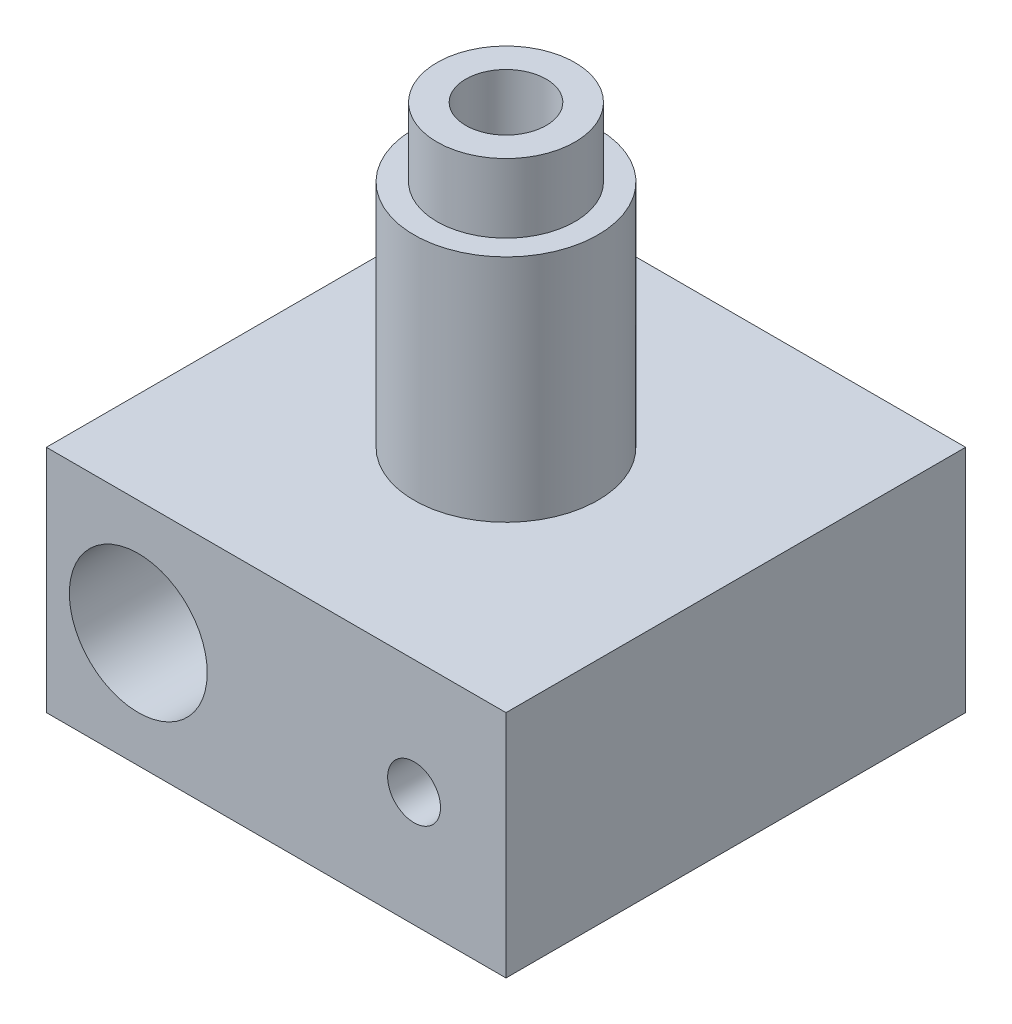
from build123d import *
from build123d.topology import SkipClean

# Parameters (mm, degrees)
SCHIZZO2_W                          = 20
SCHIZZO2_H                          = 20
SCHIZZO2_R                          = 0.15
ESTRUSIONE_ESTRUSIONE1_DEPTH        = 10
SCHIZZO3_R                          = 4
SCHIZZO3_R_2                        = 1.75
ESTRUSIONE_SOTTILE1_DEPTH           = 13
TAGLIO_ESTRUSIONE1_REACH            = 34.078
SCHIZZO4_R                          = 3
SCHIZZO4_R_2                        = 1.15
FORO_FILETTATO_M6X1_0_1_D           = 5
FORO_FILETTATO_M6X1_0_1_DEPTH       = 12
FORO_FILETTATO_M6X1_0_1_CSINK_D     = 6.05
FORO_FILETTATO_M6X1_0_1_CSINK_ANGLE = 90
FORO_FILETTATO_M6X1_0_1_TIP         = 1.502151548
SCHIZZO8_R                          = 13
SCHIZZO8_R_2                        = 3
TAGLIO_ESTRUSIONE_SOTTILE1_DEPTH    = 3


with BuildPart() as part:
    # Schizzo1 → Rivoluzione1 (revolve)
    with BuildSketch(Plane.XY):
        Polygon((-0.15, 0), (-0.15, -4), (-0.5, -4), (-3, -2), (-3, 0), align=None)
    revolve(axis=Axis((0, -26.528171736, 0), (0, 1, 0)))

    # Schizzo2 → Estrusione-Estrusione1 (add)
    with BuildSketch(Plane(origin=(0, 0, 0), x_dir=(1, 0, 0), z_dir=(0, 1, 0))):
        Rectangle(SCHIZZO2_W, SCHIZZO2_H)
        Circle(SCHIZZO2_R, mode=Mode.SUBTRACT)
    extrude(amount=ESTRUSIONE_ESTRUSIONE1_DEPTH)

    # Schizzo3 → Estrusione-Sottile1 (add)
    with SkipClean():  # the faces are left unmerged after this step: merging them gives an invalid solid
        with BuildSketch(Plane(origin=(0, 10, 0), x_dir=(1, 0, 0), z_dir=(0, 1, 0))):
            Circle(SCHIZZO3_R)
            Circle(SCHIZZO3_R_2, mode=Mode.SUBTRACT)
        extrude(amount=ESTRUSIONE_SOTTILE1_DEPTH)
    add(part.part.scale(1), mode=Mode.REPLACE)  # the faces are merged on a copy

    # Schizzo4 → Taglio-Estrusione1 (cut, up to next)
    with BuildSketch(Plane.XY.offset(10), mode=Mode.PRIVATE) as taglio_estrusione1_sk1:
        with Locations((-6, 5)):
            Circle(SCHIZZO4_R)
    taglio_estrusione1_tool1 = extrude(taglio_estrusione1_sk1.sketch, amount=-TAGLIO_ESTRUSIONE1_REACH, mode=Mode.PRIVATE) & part.part
    # Schizzo4 → Taglio-Estrusione1 (cut, up to next)
    with BuildSketch(Plane.XY.offset(10), mode=Mode.PRIVATE) as taglio_estrusione1_sk2:
        with Locations((6, 5)):
            Circle(SCHIZZO4_R_2)
    taglio_estrusione1_tool2 = extrude(taglio_estrusione1_sk2.sketch, amount=-TAGLIO_ESTRUSIONE1_REACH, mode=Mode.PRIVATE) & part.part
    add(taglio_estrusione1_tool1.solids().sort_by_distance((-6, 5, 10))[0], mode=Mode.SUBTRACT)
    add(taglio_estrusione1_tool2.solids().sort_by_distance((6, 5, 10))[0], mode=Mode.SUBTRACT)

    # Foro filettato M6x1.0-1
    with Locations(Plane(origin=(0, 0, -10), x_dir=(-1, 0, 0), z_dir=(0, 0, -1))):
        with Locations((-6, 5)):
            CounterSinkHole(FORO_FILETTATO_M6X1_0_1_D / 2, FORO_FILETTATO_M6X1_0_1_CSINK_D / 2, depth=FORO_FILETTATO_M6X1_0_1_DEPTH, counter_sink_angle=FORO_FILETTATO_M6X1_0_1_CSINK_ANGLE)
            with Locations((0, 0, -(FORO_FILETTATO_M6X1_0_1_DEPTH + FORO_FILETTATO_M6X1_0_1_TIP / 2))):  # 118° drill point
                Cone(0, FORO_FILETTATO_M6X1_0_1_D / 2, FORO_FILETTATO_M6X1_0_1_TIP, mode=Mode.SUBTRACT)

    # Schizzo8 → Taglio-Estrusione-Sottile1 (cut)
    with BuildSketch(Plane(origin=(0, 23, 0), x_dir=(1, 0, 0), z_dir=(0, 1, 0))):
        Circle(SCHIZZO8_R)
        Circle(SCHIZZO8_R_2, mode=Mode.SUBTRACT)
    extrude(amount=-TAGLIO_ESTRUSIONE_SOTTILE1_DEPTH, mode=Mode.SUBTRACT)


solid = part.part
